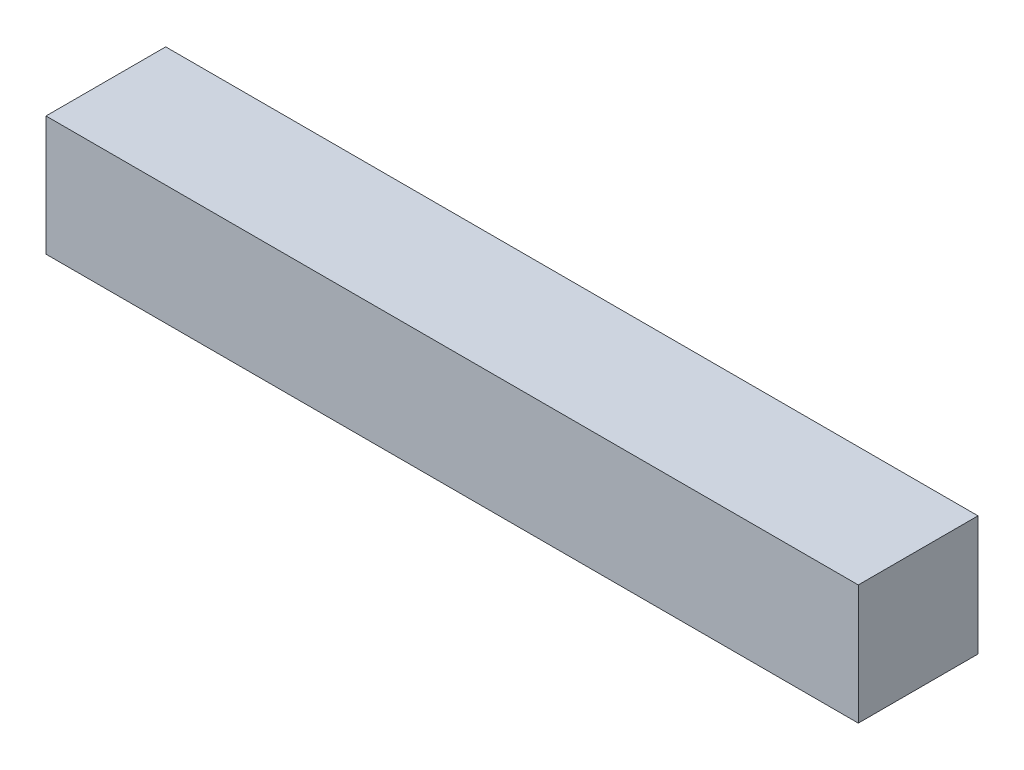
from build123d import *

# Parameters (mm, degrees)
SKETCH1_W           = 14
SKETCH1_H           = 14
BOSS_EXTRUDE1_DEPTH = 95


with BuildPart() as part:
    # Sketch1 → Boss-Extrude1 (new body)
    with BuildSketch(Plane(origin=(0, 0, 0), x_dir=(0, 0, -1), z_dir=(1, 0, 0))):
        Rectangle(SKETCH1_W, SKETCH1_H)
    extrude(amount=BOSS_EXTRUDE1_DEPTH)


solid = part.part
